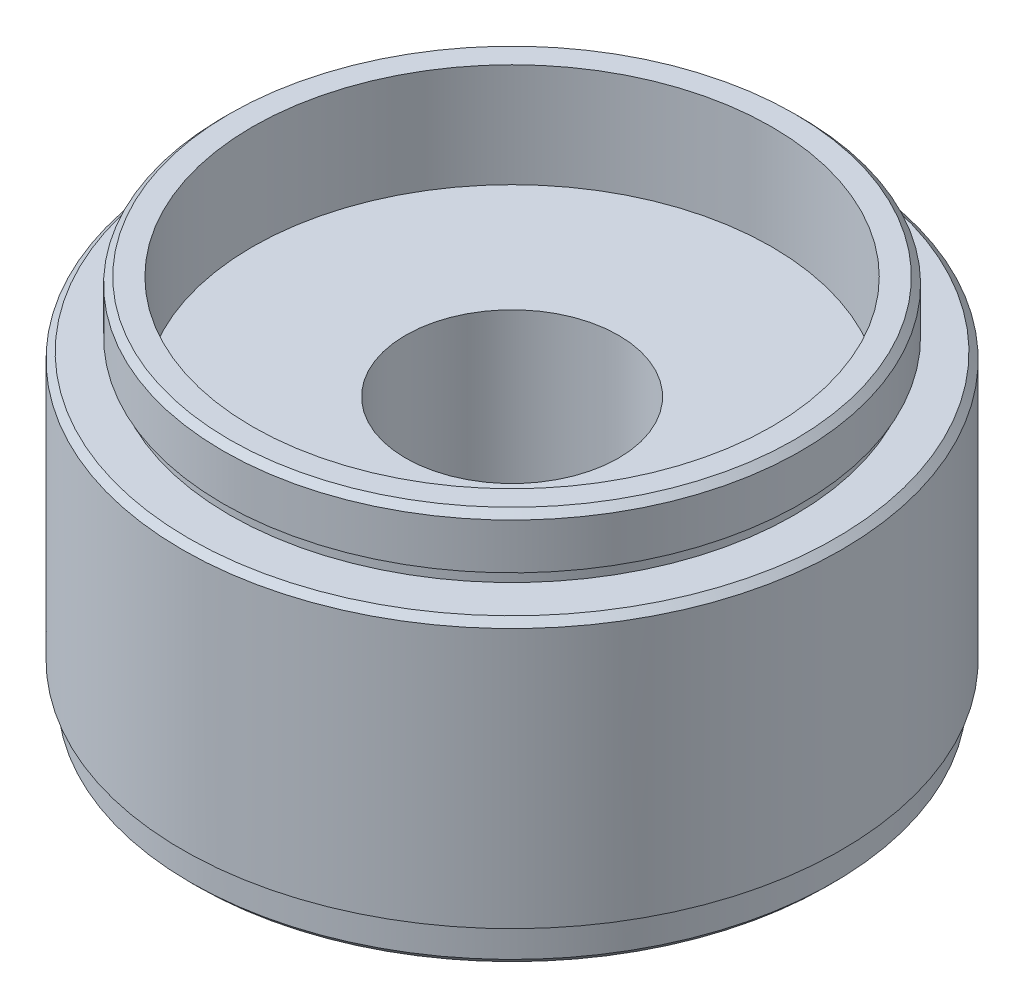
from build123d import *

# Parameters (mm, degrees)
SKETCH1_R           = 25.385
BOSS_EXTRUDE1_DEPTH = 28.54
SKETCH2_OUTSIDE_W   = 68.222
SKETCH2_OUTSIDE_H   = 68.222
SKETCH2_OUTSIDE_R   = 24.75
CUT_EXTRUDE1_DEPTH  = 3
SKETCH3_OUTSIDE_W   = 68.222
SKETCH3_OUTSIDE_H   = 68.222
SKETCH3_OUTSIDE_R   = 22.25
CUT_EXTRUDE2_DEPTH  = 5.02
SKETCH4_OUTSIDE_W   = 68.222
SKETCH4_OUTSIDE_H   = 68.222
SKETCH4_OUTSIDE_R   = 21.75
CUT_EXTRUDE3_DEPTH  = 1
SKETCH5_R           = 20
CUT_EXTRUDE4_DEPTH  = 8
SKETCH6_R           = 8.2
CUT_EXTRUDE5_DEPTH  = 46.862054577
SKETCH7_R           = 13.5
CUT_EXTRUDE6_DEPTH  = 5
CHAMFER1_SIZE       = 0.5
CHAMFER1_SIZE2      = 0.499999887
CHAMFER2_SIZE       = 0.5
CHAMFER2_SIZE2      = 0.499999887
CHAMFER3_SIZE       = 0.5
CHAMFER3_SIZE2      = 0.499999887


with BuildPart() as part:
    # Sketch1 → Boss-Extrude1 (new body)
    with BuildSketch(Plane(origin=(0, 0, 0), x_dir=(1, 0, 0), z_dir=(0, 1, 0))):
        Circle(SKETCH1_R)
    extrude(amount=BOSS_EXTRUDE1_DEPTH)

    # Sketch2 outside → Cut-Extrude1 (cut)
    with BuildSketch(Plane.XZ):
        Rectangle(SKETCH2_OUTSIDE_W, SKETCH2_OUTSIDE_H)
        Circle(SKETCH2_OUTSIDE_R, mode=Mode.SUBTRACT)
    extrude(amount=-CUT_EXTRUDE1_DEPTH, mode=Mode.SUBTRACT)

    # Sketch3 outside → Cut-Extrude2 (cut)
    with BuildSketch(Plane(origin=(0, 28.54, 0), x_dir=(1, 0, 0), z_dir=(0, 1, 0))):
        Rectangle(SKETCH3_OUTSIDE_W, SKETCH3_OUTSIDE_H)
        Circle(SKETCH3_OUTSIDE_R, mode=Mode.SUBTRACT)
    extrude(amount=-CUT_EXTRUDE2_DEPTH, mode=Mode.SUBTRACT)

    # Sketch4 outside → Cut-Extrude3 (cut)
    with BuildSketch(Plane(origin=(0, 23.52, 0), x_dir=(1, 0, 0), z_dir=(0, 1, 0))):
        Rectangle(SKETCH4_OUTSIDE_W, SKETCH4_OUTSIDE_H)
        Circle(SKETCH4_OUTSIDE_R, mode=Mode.SUBTRACT)
    extrude(amount=CUT_EXTRUDE3_DEPTH, mode=Mode.SUBTRACT)

    # Sketch5 → Cut-Extrude4 (cut)
    with BuildSketch(Plane(origin=(0, 28.54, 0), x_dir=(1, 0, 0), z_dir=(0, 1, 0))):
        Circle(SKETCH5_R)
    extrude(amount=-CUT_EXTRUDE4_DEPTH, mode=Mode.SUBTRACT)

    # Sketch6 → Cut-Extrude5 (cut, through all)
    with BuildSketch(Plane.XZ):
        Circle(SKETCH6_R)
    extrude(amount=-CUT_EXTRUDE5_DEPTH, mode=Mode.SUBTRACT)

    # Sketch7 → Cut-Extrude6 (cut)
    with BuildSketch(Plane.XZ):
        Circle(SKETCH7_R)
    extrude(amount=-CUT_EXTRUDE6_DEPTH, mode=Mode.SUBTRACT)

    # Chamfer1
    chamfer1_edges = [part.edges().sort_by_distance(p)[0] for p in [
        (-24.75, 0, 0),
    ]]
    chamfer1_side = [part.faces().sort_by_distance(p)[0] for p in [
        (-24.049964287, 0, 0),
    ]]
    chamfer(chamfer1_edges, length=CHAMFER1_SIZE, length2=CHAMFER1_SIZE2, reference=chamfer1_side[0])

    # Chamfer2
    chamfer2_edges = [part.edges().sort_by_distance(p)[0] for p in [
        (-22.25, 28.54, 0),
    ]]
    chamfer2_side = [part.faces().sort_by_distance(p)[0] for p in [
        (-21.620674965, 28.54, 0),
    ]]
    chamfer(chamfer2_edges, length=CHAMFER2_SIZE, length2=CHAMFER2_SIZE2, reference=chamfer2_side[0])

    # Chamfer3
    chamfer3_edges = [part.edges().sort_by_distance(p)[0] for p in [
        (-25.385, 23.52, 0),
    ]]
    chamfer3_side = [part.faces().sort_by_distance(p)[0] for p in [
        (-24.667003774, 23.52, 0),
    ]]
    chamfer(chamfer3_edges, length=CHAMFER3_SIZE, length2=CHAMFER3_SIZE2, reference=chamfer3_side[0])


solid = part.part
